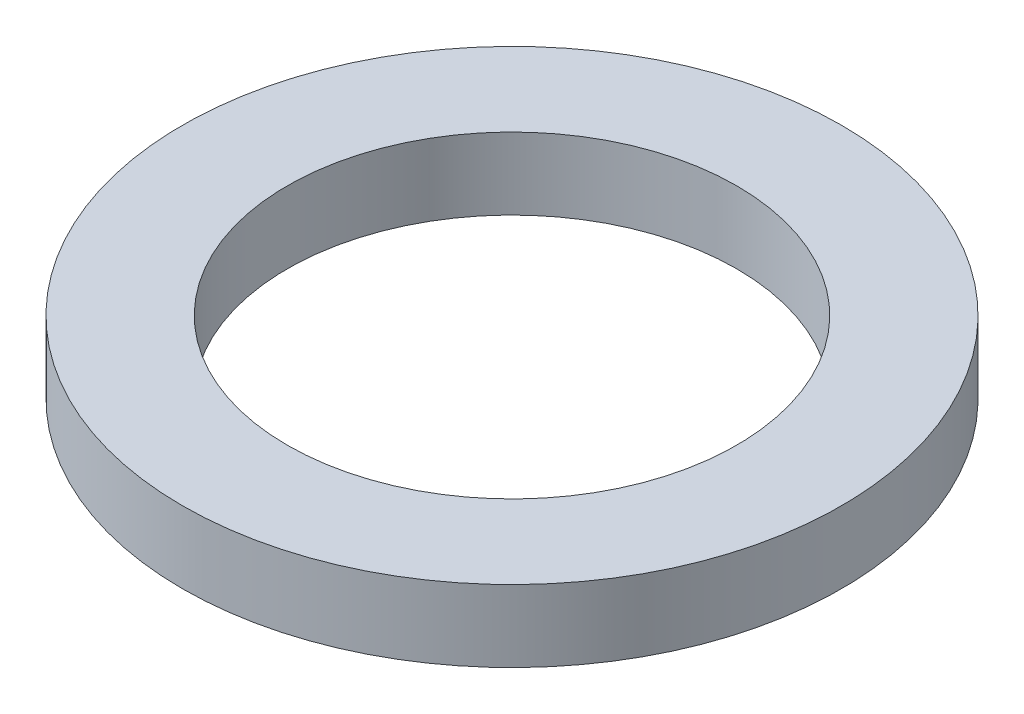
from build123d import *

# Parameters (mm, degrees)
SKETCH1_R           = 55
BOSS_EXTRUDE1_DEPTH = 12
SKETCH2_R           = 37.5
CUT_EXTRUDE1_DEPTH  = 79.70196948


with BuildPart() as part:
    # Sketch1 → Boss-Extrude1 (new body)
    with BuildSketch(Plane(origin=(0, 0, 0), x_dir=(1, 0, 0), z_dir=(0, 1, 0))):
        Circle(SKETCH1_R)
    extrude(amount=BOSS_EXTRUDE1_DEPTH)

    # Sketch2 → Cut-Extrude1 (cut, through all)
    with BuildSketch(Plane(origin=(0, 0, 0), x_dir=(1, 0, 0), z_dir=(0, 1, 0))):
        Circle(SKETCH2_R)
    extrude(amount=CUT_EXTRUDE1_DEPTH, mode=Mode.SUBTRACT)


solid = part.part
